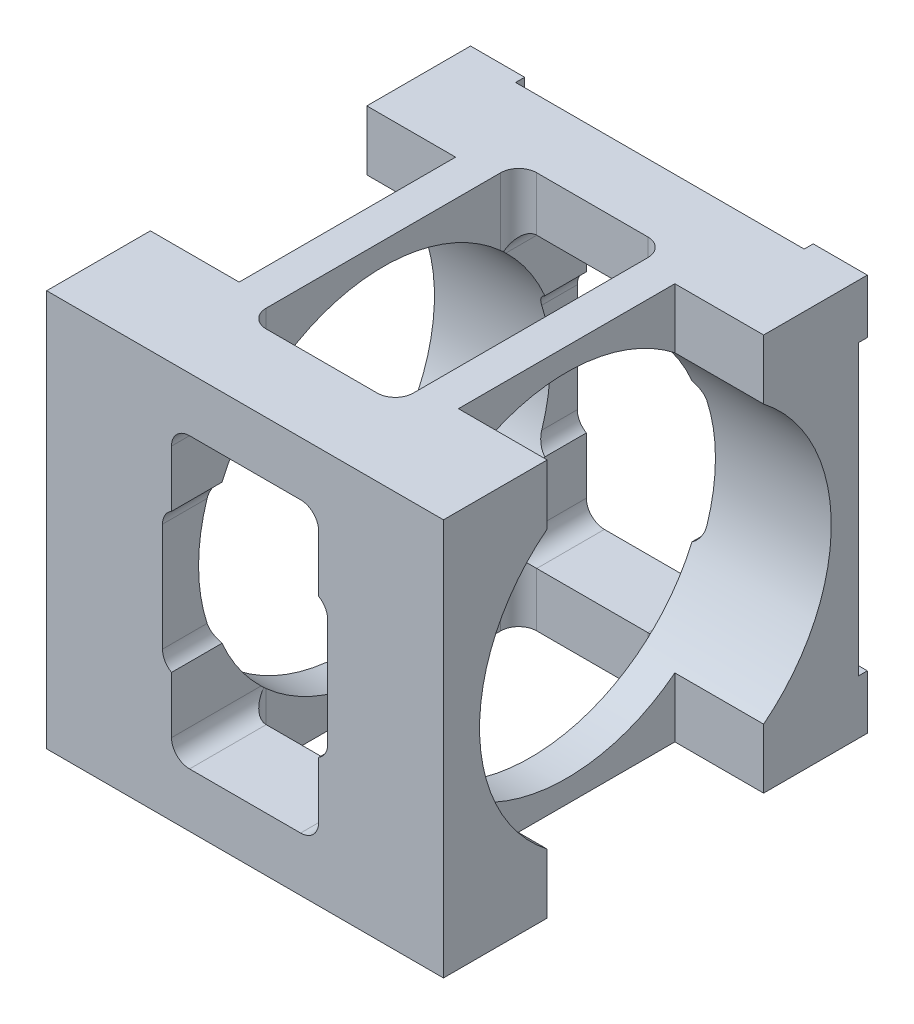
from build123d import *

# Parameters (mm, degrees)
SKETCH1_W           = 22
SKETCH1_H           = 22
BOSS_EXTRUDE1_DEPTH = 23.5
CUT_EXTRUDE1_REACH  = 71.859
SKETCH2_R           = 9.75
CUT_EXTRUDE2_DEPTH  = 0.5
SKETCH5_W           = 8.157122282
SKETCH5_H           = 16
CUT_EXTRUDE3_DEPTH  = 68.210490253
SKETCH6_W           = 8.157122282
SKETCH6_H           = 15
CUT_EXTRUDE4_DEPTH  = 35.018377386
SKETCH7_W           = 4.921438859
SKETCH7_H           = 12
CUT_EXTRUDE5_DEPTH  = 35.018377386
CUT_EXTRUDE6_DEPTH  = 68.210490253
FILLET1_R           = 1


with BuildPart() as part:
    # Sketch1 → Boss-Extrude1 (new body)
    with BuildSketch(Plane.XY):
        with Locations((0, 51)):
            Rectangle(SKETCH1_W, SKETCH1_H)
    extrude(amount=BOSS_EXTRUDE1_DEPTH)

    # Sketch2 → Cut-Extrude1 (cut, up to next)
    with BuildSketch(Plane(origin=(11, 0, 0), x_dir=(0, 0, -1), z_dir=(1, 0, 0)), mode=Mode.PRIVATE) as cut_extrude1_sk1:
        with Locations(Location((-11.75, 51, 0), (0, 0, 90))):
            Circle(SKETCH2_R)
    cut_extrude1_tool1 = extrude(cut_extrude1_sk1.sketch, amount=-CUT_EXTRUDE1_REACH, mode=Mode.PRIVATE) & part.part
    add(cut_extrude1_tool1.solids().sort_by_distance((11, 51, 11.75))[0], mode=Mode.SUBTRACT)

    # Sketch3 → Cut-Extrude2 (cut)
    with BuildSketch(Plane(origin=(0, 0, 0), x_dir=(-1, 0, 0), z_dir=(0, 0, -1))):
        Polygon((11, 43), (11, 59), (8, 59), (8, 62), (-8, 62), (-8, 59), (-11, 59), (-11, 43), (-8, 43), (-8, 40), (8, 40), (8, 43), align=None)
    extrude(amount=-CUT_EXTRUDE2_DEPTH, mode=Mode.SUBTRACT)

    # Sketch5 → Cut-Extrude3 (cut, through all)
    with BuildSketch(Plane.XY.offset(23.5)):
        with Locations((0, 51)):
            Rectangle(SKETCH5_W, SKETCH5_H)
    extrude(amount=-CUT_EXTRUDE3_DEPTH, mode=Mode.SUBTRACT)

    # Sketch6 → Cut-Extrude4 (cut, through all)
    with BuildSketch(Plane(origin=(0, 62, 0), x_dir=(1, 0, 0), z_dir=(0, 1, 0))):
        with Locations((0, -11.75)):
            Rectangle(SKETCH6_W, SKETCH6_H)
    extrude(amount=-CUT_EXTRUDE4_DEPTH, mode=Mode.SUBTRACT)

    # Sketch7 → Cut-Extrude5 (cut, through all)
    with BuildSketch(Plane(origin=(0, 62, 0), x_dir=(1, 0, 0), z_dir=(0, 1, 0))):
        with Locations((8.539280571, -11.75)):
            Rectangle(SKETCH7_W, SKETCH7_H)
        with Locations((-8.539280571, -11.75)):
            Rectangle(SKETCH7_W, SKETCH7_H)
    extrude(amount=-CUT_EXTRUDE5_DEPTH, mode=Mode.SUBTRACT)

    # Sketch8 → Cut-Extrude6 (cut, through all)
    with BuildSketch(Plane.XY.offset(23.5)):
        with BuildLine():
            Line((-3.578561141, 47), (3.578561141, 47))
            ThreePointArc((3.578561141, 47), (4.285667922, 47.292893219), (4.578561141, 48))
            Line((4.578561141, 48), (4.578561141, 54))
            ThreePointArc((4.578561141, 54), (4.285667922, 54.707106781), (3.578561141, 55))
            Line((3.578561141, 55), (-3.578561141, 55))
            ThreePointArc((-3.578561141, 55), (-4.285667922, 54.707106781), (-4.578561141, 54))
            Line((-4.578561141, 54), (-4.578561141, 48))
            ThreePointArc((-4.578561141, 48), (-4.285667922, 47.292893219), (-3.578561141, 47))
        make_face()
    extrude(amount=-CUT_EXTRUDE6_DEPTH, mode=Mode.SUBTRACT)

    # Fillet1
    # the kernel refuses this fillet: 1 mm, written as the material it adds along each edge
    with BuildSketch(Plane(origin=(4.078561141, 59, 4.25), x_dir=(-1, 0, 0), z_dir=(0, 0, -1)), Plane(origin=(4.078561141, 43, 4.25), x_dir=(0, 1, 0), z_dir=(0, 0, -1)), Plane(origin=(-4.078561141, 59, 4.25), x_dir=(0, -1, 0), z_dir=(0, 0, -1))) as fillet1_piece_1:
        with BuildLine():
            CenterArc((FILLET1_R, -FILLET1_R), FILLET1_R, 90, 90)
            Line((0, -FILLET1_R), (0, 0))
            Line((0, 0), (FILLET1_R, 0))
        make_face()
    extrude(amount=3.75)
    with BuildSketch(Plane(origin=(-4.078561141, 43, 4.25), x_dir=(0, 1, 0), z_dir=(0, 0, -1))) as fillet1_piece_2:
        with BuildLine():
            CenterArc((FILLET1_R, FILLET1_R), FILLET1_R, 180, 90)
            Line((0, FILLET1_R), (0, 0))
            Line((0, 0), (FILLET1_R, 0))
        make_face()
    extrude(amount=3.75)
    with BuildSketch(Plane(origin=(4.078561141, 59, 23.5), x_dir=(0, -1, 0), z_dir=(0, 0, -1)), Plane(origin=(-4.078561141, 43, 23.5), x_dir=(0, 1, 0), z_dir=(0, 0, -1))) as fillet1_piece_3:
        with BuildLine():
            CenterArc((FILLET1_R, FILLET1_R), FILLET1_R, 180, 90)
            Line((0, FILLET1_R), (0, 0))
            Line((0, 0), (FILLET1_R, 0))
        make_face()
    extrude(amount=4.25)
    with BuildSketch(Plane(origin=(-4.078561141, 59, 23.5), x_dir=(0, -1, 0), z_dir=(0, 0, -1)), Plane(origin=(4.078561141, 43, 23.5), x_dir=(0, 1, 0), z_dir=(0, 0, -1))) as fillet1_piece_4:
        with BuildLine():
            CenterArc((FILLET1_R, -FILLET1_R), FILLET1_R, 90, 90)
            Line((0, -FILLET1_R), (0, 0))
            Line((0, 0), (FILLET1_R, 0))
        make_face()
    extrude(amount=4.25)
    with BuildSketch(Plane(origin=(-4.078561141, 62, 4.25), x_dir=(0, 0, 1), z_dir=(0, -1, 0)), Plane(origin=(-4.078561141, 43, 4.25), x_dir=(0, 0, 1), z_dir=(0, -1, 0)), Plane(origin=(4.078561141, 62, 19.25), x_dir=(0, 0, -1), z_dir=(0, -1, 0)), Plane(origin=(-4.078561141, 43, 19.25), x_dir=(1, 0, 0), z_dir=(0, -1, 0))) as fillet1_piece_5:
        with BuildLine():
            CenterArc((FILLET1_R, -FILLET1_R), FILLET1_R, 90, 90)
            Line((0, -FILLET1_R), (0, 0))
            Line((0, 0), (FILLET1_R, 0))
        make_face()
    extrude(amount=3)
    with BuildSketch(Plane(origin=(4.078561141, 43, 4.25), x_dir=(0, 0, 1), z_dir=(0, -1, 0)), Plane(origin=(4.078561141, 62, 4.25), x_dir=(0, 0, 1), z_dir=(0, -1, 0)), Plane(origin=(4.078561141, 43, 19.25), x_dir=(-1, 0, 0), z_dir=(0, -1, 0)), Plane(origin=(-4.078561141, 62, 19.25), x_dir=(0, 0, -1), z_dir=(0, -1, 0))) as fillet1_piece_6:
        with BuildLine():
            CenterArc((FILLET1_R, FILLET1_R), FILLET1_R, 180, 90)
            Line((0, FILLET1_R), (0, 0))
            Line((0, 0), (FILLET1_R, 0))
        make_face()
    extrude(amount=3)
    with BuildSketch(Plane(origin=(4.078561141, 59, 6.75), x_dir=(-1, 0, 0), z_dir=(0, 0, -1))) as fillet1_piece_7a_section:
        with BuildLine():
            CenterArc((FILLET1_R, -FILLET1_R), FILLET1_R, 90, 90)
            Line((0, -FILLET1_R), (0, 0))
            Line((0, 0), (FILLET1_R, 0))
        make_face()
    fillet1_piece_7a = extrude(amount=6.25, mode=Mode.PRIVATE)
    fillet1_piece_7a = split(fillet1_piece_7a, bisect_by=Plane(origin=(3.830285127, 58.809985628, 4.25), z_dir=(0, 0, 1)), keep=Keep.TOP, mode=Mode.PRIVATE)
    fillet1_piece_7a = fillet1_piece_7a - Plane(origin=(3.830285127, 51, 11.75), x_dir=(0, 1, 0), z_dir=(1, 0, 0)) * Cylinder(9.75, 17, mode=Mode.PRIVATE)
    with BuildSketch(Plane(origin=(4.078561141, 62, 4.25), x_dir=(0, 0, 1), z_dir=(0, -1, 0))) as fillet1_piece_7b_section:
        with BuildLine():
            CenterArc((FILLET1_R, FILLET1_R), FILLET1_R, 180, 90)
            Line((0, FILLET1_R), (0, 0))
            Line((0, 0), (FILLET1_R, 0))
        make_face()
    fillet1_piece_7b = extrude(amount=5.5, mode=Mode.PRIVATE)
    fillet1_piece_7b = split(fillet1_piece_7b, bisect_by=Plane(origin=(3.832225581, 59, 4.443177498), z_dir=(0, -1, 0)), keep=Keep.TOP, mode=Mode.PRIVATE)
    fillet1_piece_7b = fillet1_piece_7b - Plane(origin=(3.832225581, 51, 11.75), x_dir=(0, 1, 0), z_dir=(1, 0, 0)) * Cylinder(9.75, 15, mode=Mode.PRIVATE)
    fillet1_piece_7 = fillet1_piece_7a & fillet1_piece_7b
    add(fillet1_piece_7)
    with BuildSketch(Plane(origin=(4.078561141, 43, 6.75), x_dir=(0, 1, 0), z_dir=(0, 0, -1))) as fillet1_piece_8a_section:
        with BuildLine():
            CenterArc((FILLET1_R, -FILLET1_R), FILLET1_R, 90, 90)
            Line((0, -FILLET1_R), (0, 0))
            Line((0, 0), (FILLET1_R, 0))
        make_face()
    fillet1_piece_8a = extrude(amount=6.25, mode=Mode.PRIVATE)
    fillet1_piece_8a = fillet1_piece_8a - Plane(origin=(3.830283996, 51, 11.75), x_dir=(0, 1, 0), z_dir=(1, 0, 0)) * Cylinder(9.75, 17, mode=Mode.PRIVATE)
    fillet1_piece_8a = split(fillet1_piece_8a, bisect_by=Plane(origin=(3.830283996, 43.190015611, 4.25), z_dir=(0, 0, 1)), keep=Keep.TOP, mode=Mode.PRIVATE)
    with BuildSketch(Plane(origin=(4.078561141, 45.5, 4.25), x_dir=(0, 0, 1), z_dir=(0, -1, 0))) as fillet1_piece_8b_section:
        with BuildLine():
            CenterArc((FILLET1_R, FILLET1_R), FILLET1_R, 180, 90)
            Line((0, FILLET1_R), (0, 0))
            Line((0, 0), (FILLET1_R, 0))
        make_face()
    fillet1_piece_8b = extrude(amount=5.5, mode=Mode.PRIVATE)
    fillet1_piece_8b = fillet1_piece_8b - Plane(origin=(3.832225993, 51, 11.75), x_dir=(0, 1, 0), z_dir=(1, 0, 0)) * Cylinder(9.75, 15, mode=Mode.PRIVATE)
    fillet1_piece_8b = split(fillet1_piece_8b, bisect_by=Plane(origin=(3.832225993, 43, 4.443177034), z_dir=(0, 1, 0)), keep=Keep.TOP, mode=Mode.PRIVATE)
    fillet1_piece_8 = fillet1_piece_8a & fillet1_piece_8b
    add(fillet1_piece_8)
    with BuildSketch(Plane(origin=(-4.078561141, 45.5, 4.25), x_dir=(0, 0, 1), z_dir=(0, -1, 0))) as fillet1_piece_9a_section:
        with BuildLine():
            CenterArc((FILLET1_R, -FILLET1_R), FILLET1_R, 90, 90)
            Line((0, -FILLET1_R), (0, 0))
            Line((0, 0), (FILLET1_R, 0))
        make_face()
    fillet1_piece_9a = extrude(amount=5.5, mode=Mode.PRIVATE)
    fillet1_piece_9a = fillet1_piece_9a - Plane(origin=(-3.832225993, 51, 11.75), x_dir=(0, 1, 0), z_dir=(1, 0, 0)) * Cylinder(9.75, 15, mode=Mode.PRIVATE)
    fillet1_piece_9a = split(fillet1_piece_9a, bisect_by=Plane(origin=(-3.832225993, 43, 4.443177034), z_dir=(0, 1, 0)), keep=Keep.TOP, mode=Mode.PRIVATE)
    with BuildSketch(Plane(origin=(-4.078561141, 43, 6.75), x_dir=(0, 1, 0), z_dir=(0, 0, -1))) as fillet1_piece_9b_section:
        with BuildLine():
            CenterArc((FILLET1_R, FILLET1_R), FILLET1_R, 180, 90)
            Line((0, FILLET1_R), (0, 0))
            Line((0, 0), (FILLET1_R, 0))
        make_face()
    fillet1_piece_9b = extrude(amount=6.25, mode=Mode.PRIVATE)
    fillet1_piece_9b = fillet1_piece_9b - Plane(origin=(-3.830283996, 51, 11.75), x_dir=(0, 1, 0), z_dir=(1, 0, 0)) * Cylinder(9.75, 17, mode=Mode.PRIVATE)
    fillet1_piece_9b = split(fillet1_piece_9b, bisect_by=Plane(origin=(-3.830283996, 43.190015611, 4.25), z_dir=(0, 0, 1)), keep=Keep.TOP, mode=Mode.PRIVATE)
    fillet1_piece_9 = fillet1_piece_9a & fillet1_piece_9b
    add(fillet1_piece_9)
    with BuildSketch(Plane(origin=(-4.078561141, 59, 6.75), x_dir=(0, -1, 0), z_dir=(0, 0, -1))) as fillet1_piece_10a_section:
        with BuildLine():
            CenterArc((FILLET1_R, -FILLET1_R), FILLET1_R, 90, 90)
            Line((0, -FILLET1_R), (0, 0))
            Line((0, 0), (FILLET1_R, 0))
        make_face()
    fillet1_piece_10a = extrude(amount=6.25, mode=Mode.PRIVATE)
    fillet1_piece_10a = fillet1_piece_10a - Plane(origin=(-3.830284938, 51, 11.75), x_dir=(0, 1, 0), z_dir=(1, 0, 0)) * Cylinder(9.75, 17, mode=Mode.PRIVATE)
    fillet1_piece_10a = split(fillet1_piece_10a, bisect_by=Plane(origin=(-3.830284938, 58.80998536, 4.25), z_dir=(0, 0, 1)), keep=Keep.TOP, mode=Mode.PRIVATE)
    with BuildSketch(Plane(origin=(-4.078561141, 62, 4.25), x_dir=(0, 0, 1), z_dir=(0, -1, 0))) as fillet1_piece_10b_section:
        with BuildLine():
            CenterArc((FILLET1_R, -FILLET1_R), FILLET1_R, 90, 90)
            Line((0, -FILLET1_R), (0, 0))
            Line((0, 0), (FILLET1_R, 0))
        make_face()
    fillet1_piece_10b = extrude(amount=5.5, mode=Mode.PRIVATE)
    fillet1_piece_10b = fillet1_piece_10b - Plane(origin=(-3.832225581, 51, 11.75), x_dir=(0, 1, 0), z_dir=(1, 0, 0)) * Cylinder(9.75, 15, mode=Mode.PRIVATE)
    fillet1_piece_10b = split(fillet1_piece_10b, bisect_by=Plane(origin=(-3.832225581, 59, 4.443177498), z_dir=(0, -1, 0)), keep=Keep.TOP, mode=Mode.PRIVATE)
    fillet1_piece_10 = fillet1_piece_10a & fillet1_piece_10b
    add(fillet1_piece_10)
    with BuildSketch(Plane(origin=(4.078561141, 59, 23.5), x_dir=(0, -1, 0), z_dir=(0, 0, -1))) as fillet1_piece_11a_section:
        with BuildLine():
            CenterArc((FILLET1_R, FILLET1_R), FILLET1_R, 180, 90)
            Line((0, FILLET1_R), (0, 0))
            Line((0, 0), (FILLET1_R, 0))
        make_face()
    fillet1_piece_11a = extrude(amount=6.75, mode=Mode.PRIVATE)
    fillet1_piece_11a = fillet1_piece_11a - Plane(origin=(3.830283996, 51, 11.75), x_dir=(0, 1, 0), z_dir=(1, 0, 0)) * Cylinder(9.75, 18, mode=Mode.PRIVATE)
    fillet1_piece_11a = split(fillet1_piece_11a, bisect_by=Plane(origin=(3.830283996, 58.80998439, 19.25), z_dir=(0, 0, -1)), keep=Keep.TOP, mode=Mode.PRIVATE)
    with BuildSketch(Plane(origin=(4.078561141, 62, 19.25), x_dir=(0, 0, -1), z_dir=(0, -1, 0))) as fillet1_piece_11b_section:
        with BuildLine():
            CenterArc((FILLET1_R, -FILLET1_R), FILLET1_R, 90, 90)
            Line((0, -FILLET1_R), (0, 0))
            Line((0, 0), (FILLET1_R, 0))
        make_face()
    fillet1_piece_11b = extrude(amount=5.5, mode=Mode.PRIVATE)
    fillet1_piece_11b = fillet1_piece_11b - Plane(origin=(3.832225993, 51, 11.75), x_dir=(0, 1, 0), z_dir=(1, 0, 0)) * Cylinder(9.75, 15, mode=Mode.PRIVATE)
    fillet1_piece_11b = split(fillet1_piece_11b, bisect_by=Plane(origin=(3.832225993, 59, 19.056822966), z_dir=(0, -1, 0)), keep=Keep.TOP, mode=Mode.PRIVATE)
    fillet1_piece_11 = fillet1_piece_11a & fillet1_piece_11b
    add(fillet1_piece_11)
    with BuildSketch(Plane(origin=(-4.078561141, 62, 19.25), x_dir=(0, 0, -1), z_dir=(0, -1, 0))) as fillet1_piece_12a_section:
        with BuildLine():
            CenterArc((FILLET1_R, FILLET1_R), FILLET1_R, 180, 90)
            Line((0, FILLET1_R), (0, 0))
            Line((0, 0), (FILLET1_R, 0))
        make_face()
    fillet1_piece_12a = extrude(amount=5.5, mode=Mode.PRIVATE)
    fillet1_piece_12a = fillet1_piece_12a - Plane(origin=(-3.832225993, 51, 11.75), x_dir=(0, 1, 0), z_dir=(1, 0, 0)) * Cylinder(9.75, 15, mode=Mode.PRIVATE)
    fillet1_piece_12a = split(fillet1_piece_12a, bisect_by=Plane(origin=(-3.832225993, 59, 19.056822966), z_dir=(0, -1, 0)), keep=Keep.TOP, mode=Mode.PRIVATE)
    with BuildSketch(Plane(origin=(-4.078561141, 59, 23.5), x_dir=(0, -1, 0), z_dir=(0, 0, -1))) as fillet1_piece_12b_section:
        with BuildLine():
            CenterArc((FILLET1_R, -FILLET1_R), FILLET1_R, 90, 90)
            Line((0, -FILLET1_R), (0, 0))
            Line((0, 0), (FILLET1_R, 0))
        make_face()
    fillet1_piece_12b = extrude(amount=6.75, mode=Mode.PRIVATE)
    fillet1_piece_12b = fillet1_piece_12b - Plane(origin=(-3.830283996, 51, 11.75), x_dir=(0, 1, 0), z_dir=(1, 0, 0)) * Cylinder(9.75, 18, mode=Mode.PRIVATE)
    fillet1_piece_12b = split(fillet1_piece_12b, bisect_by=Plane(origin=(-3.830283996, 58.809984389, 19.25), z_dir=(0, 0, -1)), keep=Keep.TOP, mode=Mode.PRIVATE)
    fillet1_piece_12 = fillet1_piece_12a & fillet1_piece_12b
    add(fillet1_piece_12)
    with BuildSketch(Plane(origin=(-4.078561141, 45.5, 19.25), x_dir=(1, 0, 0), z_dir=(0, -1, 0))) as fillet1_piece_13a_section:
        with BuildLine():
            CenterArc((FILLET1_R, -FILLET1_R), FILLET1_R, 90, 90)
            Line((0, -FILLET1_R), (0, 0))
            Line((0, 0), (FILLET1_R, 0))
        make_face()
    fillet1_piece_13a = extrude(amount=5.5, mode=Mode.PRIVATE)
    fillet1_piece_13a = split(fillet1_piece_13a, bisect_by=Plane(origin=(-3.832225691, 43, 19.056822612), z_dir=(0, 1, 0)), keep=Keep.TOP, mode=Mode.PRIVATE)
    fillet1_piece_13a = fillet1_piece_13a - Plane(origin=(-3.832225691, 51, 11.75), x_dir=(0, 1, 0), z_dir=(1, 0, 0)) * Cylinder(9.75, 15, mode=Mode.PRIVATE)
    with BuildSketch(Plane(origin=(-4.078561141, 43, 23.5), x_dir=(0, 1, 0), z_dir=(0, 0, -1))) as fillet1_piece_13b_section:
        with BuildLine():
            CenterArc((FILLET1_R, FILLET1_R), FILLET1_R, 180, 90)
            Line((0, FILLET1_R), (0, 0))
            Line((0, 0), (FILLET1_R, 0))
        make_face()
    fillet1_piece_13b = extrude(amount=6.75, mode=Mode.PRIVATE)
    fillet1_piece_13b = split(fillet1_piece_13b, bisect_by=Plane(origin=(-3.830284938, 43.190014641, 19.25), z_dir=(0, 0, -1)), keep=Keep.TOP, mode=Mode.PRIVATE)
    fillet1_piece_13b = fillet1_piece_13b - Plane(origin=(-3.830284938, 51, 11.75), x_dir=(0, 1, 0), z_dir=(1, 0, 0)) * Cylinder(9.75, 18, mode=Mode.PRIVATE)
    fillet1_piece_13 = fillet1_piece_13a & fillet1_piece_13b
    add(fillet1_piece_13)
    with BuildSketch(Plane(origin=(4.078561141, 45.5, 19.25), x_dir=(-1, 0, 0), z_dir=(0, -1, 0))) as fillet1_piece_14a_section:
        with BuildLine():
            CenterArc((FILLET1_R, FILLET1_R), FILLET1_R, 180, 90)
            Line((0, FILLET1_R), (0, 0))
            Line((0, 0), (FILLET1_R, 0))
        make_face()
    fillet1_piece_14a = extrude(amount=5.5, mode=Mode.PRIVATE)
    fillet1_piece_14a = split(fillet1_piece_14a, bisect_by=Plane(origin=(3.832225691, 43, 19.056822612), z_dir=(0, 1, 0)), keep=Keep.TOP, mode=Mode.PRIVATE)
    fillet1_piece_14a = fillet1_piece_14a - Plane(origin=(3.832225691, 51, 11.75), x_dir=(0, 1, 0), z_dir=(1, 0, 0)) * Cylinder(9.75, 15, mode=Mode.PRIVATE)
    with BuildSketch(Plane(origin=(4.078561141, 43, 23.5), x_dir=(0, 1, 0), z_dir=(0, 0, -1))) as fillet1_piece_14b_section:
        with BuildLine():
            CenterArc((FILLET1_R, -FILLET1_R), FILLET1_R, 90, 90)
            Line((0, -FILLET1_R), (0, 0))
            Line((0, 0), (FILLET1_R, 0))
        make_face()
    fillet1_piece_14b = extrude(amount=6.75, mode=Mode.PRIVATE)
    fillet1_piece_14b = split(fillet1_piece_14b, bisect_by=Plane(origin=(3.830284938, 43.190014641, 19.25), z_dir=(0, 0, -1)), keep=Keep.TOP, mode=Mode.PRIVATE)
    fillet1_piece_14b = fillet1_piece_14b - Plane(origin=(3.830284938, 51, 11.75), x_dir=(0, 1, 0), z_dir=(1, 0, 0)) * Cylinder(9.75, 18, mode=Mode.PRIVATE)
    fillet1_piece_14 = fillet1_piece_14a & fillet1_piece_14b
    add(fillet1_piece_14)


solid = part.part
